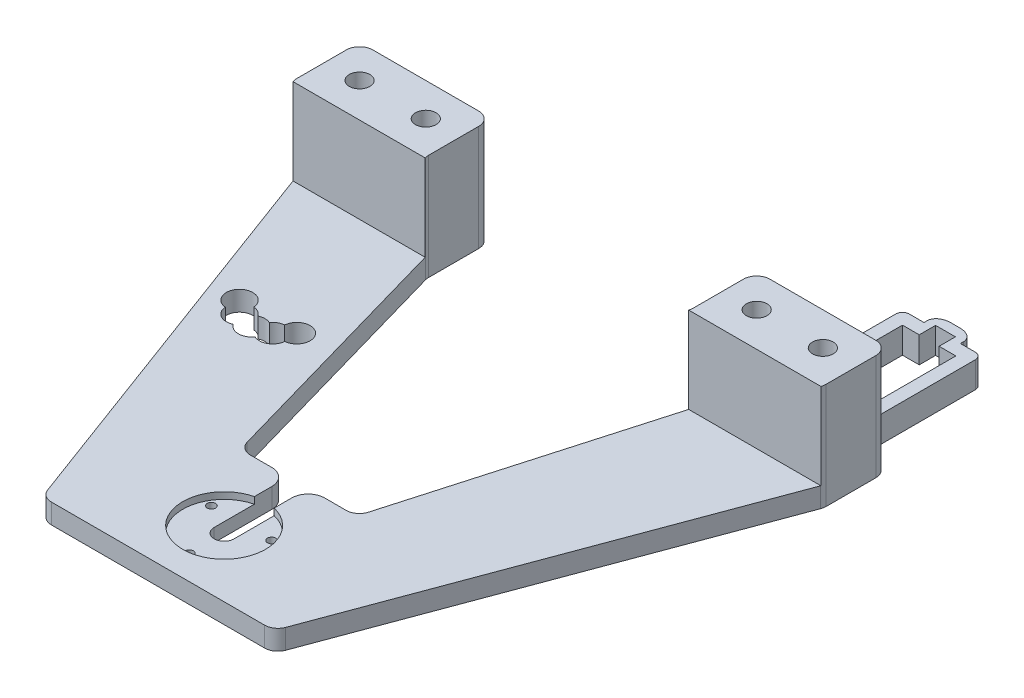
from build123d import *

# Parameters (mm, degrees)
SKETCH1_R            = 3.96875
BOSS_EXTRUDE2_DEPTH  = 40.64
SKETCH4_R            = 1.5875
CUT_EXTRUDE1_DEPTH   = 210.749095026
CUT_EXTRUDE2_START   = 5.08
SKETCH5_R            = 15.875
CUT_EXTRUDE2_DEPTH   = 5.08
SKETCH7_W            = 321.437634852
SKETCH7_H            = 153.081921076
CUT_EXTRUDE3_DEPTH   = 33.02
CUT_EXTRUDE5_DEPTH   = 210.749095026
FILLET1_R            = 6.35
FILLET2_R            = 6.35
EXTRUDE_THIN1_DEPTH  = 10
SKETCH14_R           = 1.950000064
CUT_EXTRUDE6_DEPTH   = 20
BOSS_EXTRUDE4_DEPTH  = 5
MIRROR5_COPY_1_DEPTH = 5
FILLET3_R            = 2.54
SKETCH20_W           = 13.97
SKETCH20_H           = 5.08
BOSS_EXTRUDE5_DEPTH  = 10
FILLET7_SIZE         = 3.81
FILLET7_SIZE_2       = 5.08
FILLET6_SIZE         = 3.81
FILLET6_SIZE_2       = 5.08
CUT_EXTRUDE10_START  = -5
SKETCH19_W           = 7.62
SKETCH19_H           = 10.16
CUT_EXTRUDE10_DEPTH  = 6.27
MIRROR6_OUTLINE_W    = 7.62
MIRROR6_OUTLINE_H    = 5
MIRROR6_DEPTH        = 10
MIRROR6_2_DEPTH      = 10
SKETCH21_W           = 77.087164644
SKETCH21_H           = 69.073945867
CUT_EXTRUDE11_DEPTH  = 210.74909516
SKETCH22_R           = 4.953
BOSS_EXTRUDE6_DEPTH  = 10.16
SKETCH23_R           = 5.08
CUT_EXTRUDE12_DEPTH  = 255.54404949


# Read off the part's stored shape, not the designer's step: Mirror6
with BuildPart() as part:
    # Sketch1 → Boss-Extrude2 (new body)
    with BuildSketch(Plane(origin=(0, 0, 0), x_dir=(1, 0, 0), z_dir=(0, 1, 0))):
        with BuildLine():
            Line((-96.52, 178.942765331), (-55.88, 178.942765331))
            ThreePointArc((-55.88, 178.942765331), (-52.287897552, 177.454867779), (-50.8, 173.862765331))
            Line((-50.8, 173.862765331), (-50.8, 154.610881096))
            ThreePointArc((-50.8, 154.610881096), (-50.750979429, 153.906859803), (-50.604863787, 153.216425724))
            Line((-50.604863787, 153.216425724), (-23.277092285, 57.485544628))
            ThreePointArc((-23.277092285, 57.485544628), (-21.451849938, 54.824742099), (-18.392228498, 53.8))
            Line((-18.392228498, 53.8), (0, 53.8))
            Line((0, 53.8), (0, 0))
            Line((0, 0), (-40.91748188, 0))
            ThreePointArc((-40.91748188, 0), (-43.817717665, 0.909264766), (-45.679732106, 3.31156205))
            Line((-45.679732106, 3.31156205), (-101.282250226, 153.044327381))
            ThreePointArc((-101.282250226, 153.044327381), (-101.519931557, 153.914386555), (-101.6, 154.812765331))
            Line((-101.6, 154.812765331), (-101.6, 173.862765331))
            ThreePointArc((-101.6, 173.862765331), (-100.112102448, 177.454867779), (-96.52, 178.942765331))
        make_face()
        with Locations(Location((-88.9, 166.242765331, 0), (0, 0, 270))):
            Circle(SKETCH1_R, mode=Mode.SUBTRACT)
        with Locations(Location((-63.5, 166.242765331, 0), (0, 0, 270))):
            Circle(SKETCH1_R, mode=Mode.SUBTRACT)
    boss_extrude2 = extrude(amount=BOSS_EXTRUDE2_DEPTH)

    # Mirror1: Boss-Extrude2 across plane
    add(boss_extrude2.mirror(Plane(origin=(0, 40.64, -53.8), x_dir=(0, 0, 1), z_dir=(-1, 0, 0))))

    # Sketch4 → Cut-Extrude1 (cut, through all)
    with BuildSketch(Plane(origin=(0, 40.64, 0), x_dir=(1, 0, 0), z_dir=(0, 1, 0))):
        with Locations(Location((11.548448759, 32.0195, 0), (0, 0, 270))):
            Circle(SKETCH4_R)
        with Locations(Location((0, 12.017, 0), (0, 0, 270))):
            Circle(SKETCH4_R)
        with Locations(Location((-11.548448759, 32.0195, 0), (0, 0, 270))):
            Circle(SKETCH4_R)
    extrude(amount=-CUT_EXTRUDE1_DEPTH, mode=Mode.SUBTRACT)

    # Sketch5 → Cut-Extrude2 (cut)
    with BuildSketch(Plane(origin=(0, 0, 0), x_dir=(1, 0, 0), z_dir=(0, 1, 0)).offset(CUT_EXTRUDE2_START)):
        with Locations(Location((0, 25.352, 0), (0, 0, 270))):
            Circle(SKETCH5_R)
    extrude(amount=CUT_EXTRUDE2_DEPTH, mode=Mode.SUBTRACT)

    # Sketch7 → Cut-Extrude3 (cut)
    with BuildSketch(Plane(origin=(0, 40.64, 0), x_dir=(1, 0, 0), z_dir=(0, 1, 0))):
        with Locations((5.589227859, 76.540960538)):
            Rectangle(SKETCH7_W, SKETCH7_H)
    extrude(amount=-CUT_EXTRUDE3_DEPTH, mode=Mode.SUBTRACT)

    # Sketch8 → Cut-Extrude5 (cut, through all)
    with BuildSketch(Plane(origin=(0, 0, 0), x_dir=(1, 0, 0), z_dir=(0, 1, 0))):
        with BuildLine():
            Line((-3.81, 25.352), (-3.81, 53.8))
            ThreePointArc((-3.81, 53.8), (0, 57.61), (3.81, 53.8))
            Line((3.81, 53.8), (3.81, 25.352))
            ThreePointArc((3.81, 25.352), (0, 21.542), (-3.81, 25.352))
        make_face()
    extrude(amount=CUT_EXTRUDE5_DEPTH, mode=Mode.SUBTRACT)

    # Fillet1
    fillet1_edges = [part.edges().sort_by_distance(p)[0] for p in [
        (-3.81, 3.81, -53.8),
    ]]
    fillet(fillet1_edges, radius=FILLET1_R)

    # Fillet2
    fillet2_edges = [part.edges().sort_by_distance(p)[0] for p in [
        (3.81, 3.81, -53.8),
    ]]
    fillet(fillet2_edges, radius=FILLET2_R)

    # Sketch9 → Extrude-Thin1 (add)
    with BuildSketch(Plane(origin=(0, 0, 0), x_dir=(1, 0, 0), z_dir=(0, 1, 0))):
        Polygon((-91.44, 173.942765331), (-91.44, 224.742765331), (-60.96, 224.742765331), (-60.96, 173.942765331), (-65.96, 173.942765331), (-65.96, 219.742765331), (-86.44, 219.742765331), (-86.44, 173.942765331), align=None)
    extrude_thin1 = extrude(amount=EXTRUDE_THIN1_DEPTH)

    # Sketch14 → Cut-Extrude6 (cut)
    with BuildSketch(Plane.XZ):
        with Locations(Location((-81.2, -174.942765331, 0), (0, 0, 270))):
            Circle(SKETCH14_R)
        with Locations(Location((-71.2, -174.942765331, 0), (0, 0, 270))):
            Circle(SKETCH14_R)
    cut_extrude6 = extrude(amount=-CUT_EXTRUDE6_DEPTH, mode=Mode.SUBTRACT)

    # Sketch18 → Boss-Extrude4 (add)
    with BuildSketch(Plane(origin=(-60.96, 10, -178.942765331), x_dir=(0, 0, 1), z_dir=(-1, 0, 0))):
        Polygon((-1.27, 0), (0, 1.524), (0, 0), align=None)
    boss_extrude4 = extrude(amount=BOSS_EXTRUDE4_DEPTH)

    # Mirror3: Boss-Extrude4 across plane
    add(boss_extrude4.mirror(Plane(origin=(-76.2, 0, 0), x_dir=(0, 0, 1), z_dir=(1, 0, 0))))

    # Mirror5: Extrude-Thin1, Cut-Extrude6, Boss-Extrude4 across plane
    add(extrude_thin1.mirror(Plane(origin=(0, 0, 0), x_dir=(0, 0, 1), z_dir=(1, 0, 0))))
    add(cut_extrude6.mirror(Plane(origin=(0, 0, 0), x_dir=(0, 0, 1), z_dir=(1, 0, 0))), mode=Mode.SUBTRACT)
    add(boss_extrude4.mirror(Plane(origin=(0, 0, 0), x_dir=(0, 0, 1), z_dir=(1, 0, 0))))

    # Mirror5 copy 1 sketch → Mirror5 copy 1 (add)
    with BuildSketch(Plane(origin=(91.44, 10, -178.942765331), x_dir=(0, 0, 1), z_dir=(-1, 0, 0))):
        Polygon((-1.27, 0), (0, 1.524), (0, 0), align=None)
    extrude(amount=MIRROR5_COPY_1_DEPTH)

    # Fillet3
    fillet3_edges = [part.edges().sort_by_distance(p)[0] for p in [
        (-91.44, 5, -224.742765331),
        (-60.96, 5, -224.742765331),
        (91.44, 5, -224.742765331),
        (60.96, 5, -224.742765331),
    ]]
    fillet(fillet3_edges, radius=FILLET3_R)

    # Sketch20 → Boss-Extrude5 (add)
    with BuildSketch(Plane(origin=(0, 0, 0), x_dir=(1, 0, 0), z_dir=(0, 1, 0))):
        with Locations((-76.2, 227.282765331)):
            Rectangle(SKETCH20_W, SKETCH20_H)
    extrude(amount=BOSS_EXTRUDE5_DEPTH)

    # Fillet7
    # an asymmetric fillet: 5.08, 3.81 mm, written as the material it takes off along each edge
    with BuildSketch(Plane(origin=(-83.185, -12.7, -229.822765331), x_dir=(0, 0, 1), z_dir=(0, 1, 0))) as fillet7_piece_1:
        with BuildLine():
            Bezier((FILLET7_SIZE, 0), (0, 0), (0, FILLET7_SIZE_2), weights=[1, 0.707106781, 1])
            Line((0, FILLET7_SIZE_2), (0, 0))
            Line((0, 0), (FILLET7_SIZE, 0))
        make_face()
    extrude(amount=35.4, mode=Mode.SUBTRACT)

    # Fillet6
    # an asymmetric fillet: 5.08, 3.81 mm, written as the material it takes off along each edge
    with BuildSketch(Plane(origin=(-69.215, -12.7, -229.822765331), x_dir=(0, 0, 1), z_dir=(0, 1, 0))) as fillet6_piece_1:
        with BuildLine():
            Bezier((FILLET6_SIZE, 0), (0, 0), (0, -FILLET6_SIZE_2), weights=[1, 0.707106781, 1])
            Line((0, -FILLET6_SIZE_2), (0, 0))
            Line((0, 0), (FILLET6_SIZE, 0))
        make_face()
    extrude(amount=35.4, mode=Mode.SUBTRACT)

    # Sketch19 → Cut-Extrude10 (cut)
    with BuildSketch(Plane(origin=(0, 0, -224.742765331), x_dir=(-1, 0, 0), z_dir=(0, 0, -1)).offset(CUT_EXTRUDE10_START)):
        with Locations((76.2, 4.92)):
            Rectangle(SKETCH19_W, SKETCH19_H)
    extrude(amount=CUT_EXTRUDE10_DEPTH, mode=Mode.SUBTRACT)

    # Mirror6 outline → Mirror6 (cut)
    with BuildSketch(Plane(origin=(0, 0, 0), x_dir=(1, 0, 0), z_dir=(0, 1, 0))):
        with Locations((76.2, 222.242765331)):
            Rectangle(MIRROR6_OUTLINE_W, MIRROR6_OUTLINE_H)
    extrude(amount=MIRROR6_DEPTH, mode=Mode.SUBTRACT)

    # Mirror6 2 outline → Mirror6 2 (add)
    with BuildSketch(Plane(origin=(0, 0, 0), x_dir=(1, 0, 0), z_dir=(0, 1, 0))):
        with BuildLine():
            add(Edge.make_bspline(
                [(78.105, 229.822765331), (83.185, 229.822765331), (83.185, 226.012765331)],
                knots=[0, 0, 0, 1, 1, 1], degree=2, weights=[1, 0.707106781, 1]))
            Line((78.105, 229.822765331), (74.295, 229.822765331))
            add(Edge.make_bspline(
                [(69.215, 226.012765331), (69.215, 229.822765331), (74.295, 229.822765331)],
                knots=[0, 0, 0, 1, 1, 1], degree=2, weights=[1, 0.707106781, 1]))
            Line((69.215, 226.012765331), (69.215, 224.742765331))
            Line((69.215, 224.742765331), (72.39, 224.742765331))
            Line((72.39, 224.742765331), (72.39, 226.012765331))
            Line((72.39, 226.012765331), (80.01, 226.012765331))
            Line((80.01, 226.012765331), (80.01, 224.742765331))
            Line((80.01, 224.742765331), (83.185, 224.742765331))
            Line((83.185, 224.742765331), (83.185, 226.012765331))
        make_face()
    extrude(amount=MIRROR6_2_DEPTH)

    # Sketch21 → Cut-Extrude11 (cut, through all)
    with BuildSketch(Plane(origin=(0, 0, -178.942765331), x_dir=(-1, 0, 0), z_dir=(0, 0, -1))):
        with Locations((78.752430528, 22.788762469)):
            Rectangle(SKETCH21_W, SKETCH21_H)
    extrude(amount=CUT_EXTRUDE11_DEPTH, mode=Mode.SUBTRACT)

    # Sketch22 → Boss-Extrude6 (add)
    with BuildSketch(Plane.XZ):
        with Locations(Location((-60.96, -109.572454465, 0), (0, 0, 90))):
            Circle(SKETCH22_R)
    extrude(amount=BOSS_EXTRUDE6_DEPTH)

    # Sketch23 → Cut-Extrude12 (cut, through all)
    with BuildSketch(Plane.XZ):
        with Locations((-67.31, -98.573931837)):
            Circle(SKETCH23_R)
        with Locations((-71.958522628, -103.222454465)):
            Circle(SKETCH23_R)
        with Locations((-60.96, -96.872454465)):
            Circle(SKETCH23_R)
        with Locations((-54.61, -98.573931837)):
            Circle(SKETCH23_R)
        with Locations((-49.961477372, -103.222454465)):
            Circle(SKETCH23_R)
    extrude(amount=-CUT_EXTRUDE12_DEPTH, mode=Mode.SUBTRACT)


solid = part.part
